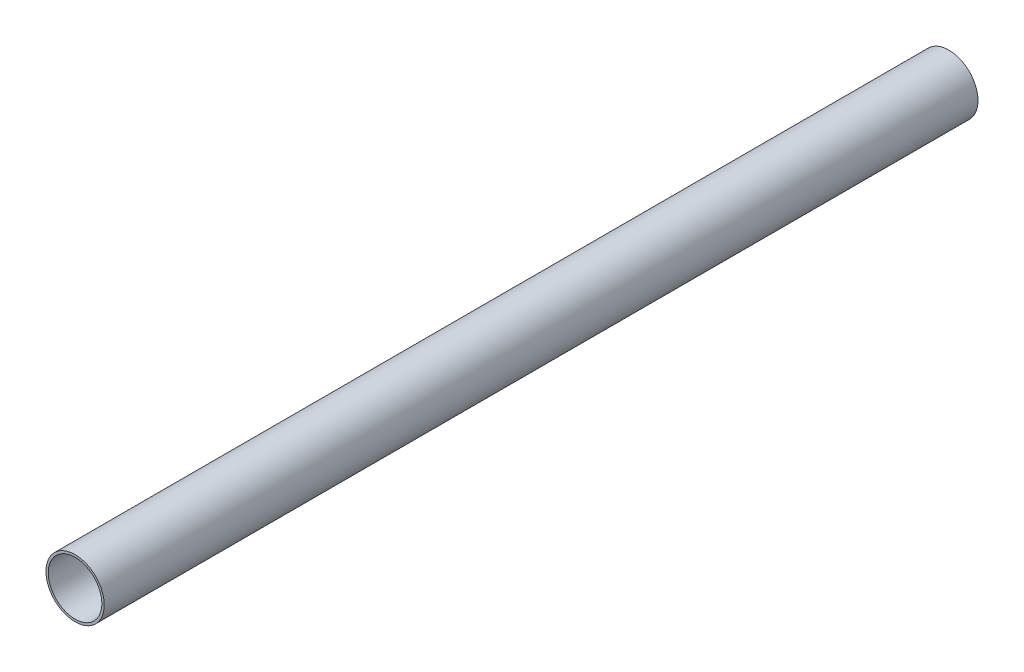
from build123d import *

# Parameters (mm, degrees)
SKETCH_1_R      = 50
SKETCH_1_R_2    = 46
EXTRUDE_1_DEPTH = 1500


with BuildPart() as part:
    # Эскиз1 → Бобышка-Вытянуть1 (new body)
    with BuildSketch(Plane.XY):
        Circle(SKETCH_1_R)
        Circle(SKETCH_1_R_2, mode=Mode.SUBTRACT)
    extrude(amount=EXTRUDE_1_DEPTH)


solid = part.part
